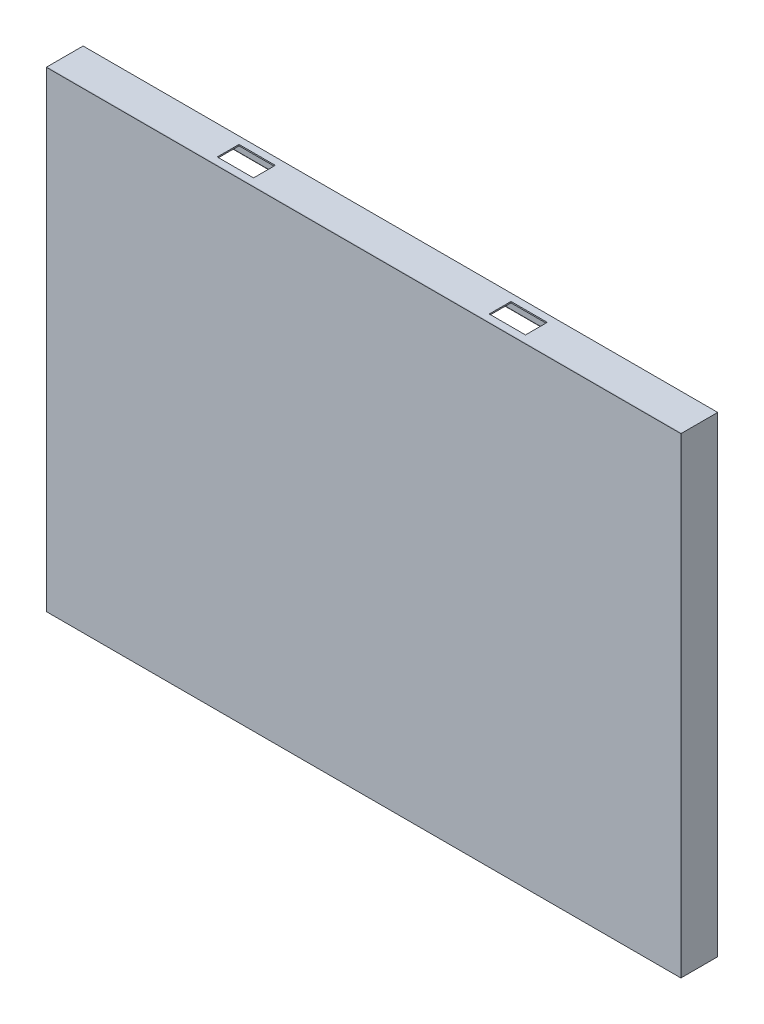
from build123d import *

# Parameters (mm, degrees)
MEMBER_1_DEPTH       = 2813.906082581
MEMBER_1_DEPTH_BACK  = 213.906082581
MEMBER_1_2_DEPTH     = 3927.812165162
MEMBER_1_3_DEPTH     = 3027.812165162
MEMBER_1_4_DEPTH     = 3927.812165162
MEMBER_2_DEPTH       = 2600
MEMBER_3_DEPTH       = 2600
MEMBER_4_DEPTH       = 3500
MEMBER_5_DEPTH       = 3500
WELD_START           = -1743
WELD_TRIM_1_DEPTH    = 1443
WELD_START_2         = -351
WELD_TRIM_1_2_DEPTH  = 75
WELD_START_3         = 300
WELD_TRIM_1_3_DEPTH  = 1443
WELD_TRIM_1_4_DEPTH  = 75
WELD_START_4         = -350
WELD_TRIM_1_5_DEPTH  = 73
WELD_TRIM_1_6_DEPTH  = 1443
WELD_START_5         = 176
WELD_TRIM_1_7_DEPTH  = 75
WELD_TRIM_1_8_DEPTH  = 1443
WELD_TRIM_1_9_DEPTH  = 75
WELD_START_6         = 177
WELD_TRIM_1_10_DEPTH = 73
WELD_START_7         = -301
WELD_TRIM_2_DEPTH    = 75
WELD_START_8         = 226
WELD_TRIM_2_2_DEPTH  = 75
SKETCH_11_W          = 3500
SKETCH_11_H          = 2600
EXTRUDE_3_DEPTH      = 3
SKETCH_14_W          = 200
SKETCH_14_H          = 120
CUT_EXTRUDE_3_DEPTH  = 10
SKETCH_15_W          = 200
SKETCH_15_H          = 120
CUT_EXTRUDE_4_DEPTH  = 3141.461749488


with BuildPart() as part:
    # Sketch1 → Member 1 (new, two sides: drawn at the far end of the back side and taken through both)
    with BuildSketch(Plane(origin=(-1750, -1300, 0), x_dir=(-1, 0, 0), z_dir=(0, 1, 0)).offset(-MEMBER_1_DEPTH_BACK)):
        with BuildLine():
            Line((0, 0), (0, -200))
            Line((0, -200), (-73, -200))
            Line((-73, -200), (-73, -196.033179359))
            ThreePointArc((-73, -196.033179359), (-71.483577577, -192.240936001), (-67.770505569, -190.539835501))
            Line((-67.770505569, -190.539835501), (-17.458988863, -188.062374452))
            ThreePointArc((-17.458988863, -188.062374452), (-10.032844845, -184.660173452), (-7, -177.075686736))
            Line((-7, -177.075686736), (-7, -22.924313264))
            ThreePointArc((-7, -22.924313264), (-10.032844845, -15.339826548), (-17.458988863, -11.937625548))
            Line((-17.458988863, -11.937625548), (-67.770505569, -9.460164499))
            ThreePointArc((-67.770505569, -9.460164499), (-71.483577577, -7.759063999), (-73, -3.966820641))
            Line((-73, -3.966820641), (-73, 0))
            Line((-73, 0), (0, 0))
        make_face()
    extrude(amount=MEMBER_1_DEPTH + MEMBER_1_DEPTH_BACK)

    # Member 1 mitre 1
    split(bisect_by=Plane(origin=(-1750, -1300, 0), x_dir=(-0.707106781, -0.707106781, 0), z_dir=(-0.707106781, 0.707106781, 0)), keep=Keep.TOP)

    # Member 1 mitre 2
    split(bisect_by=Plane(origin=(-1750, 1300, 0), x_dir=(0.707106781, -0.707106781, 0), z_dir=(-0.707106781, -0.707106781, 0)), keep=Keep.TOP)


with BuildPart() as body_2:
    # Sketch1 on segment 2 (carried to segment 2) → Member 1 2 (new body)
    with BuildSketch(Plane(origin=(-1963.906082581, 1300, 0), x_dir=(0, 1, 0), z_dir=(1, 0, 0))):
        with BuildLine():
            Line((0, 0), (0, -200))
            Line((0, -200), (-73, -200))
            Line((-73, -200), (-73, -196.033179359))
            ThreePointArc((-73, -196.033179359), (-71.483577577, -192.240936001), (-67.770505569, -190.539835501))
            Line((-67.770505569, -190.539835501), (-17.458988863, -188.062374452))
            ThreePointArc((-17.458988863, -188.062374452), (-10.032844845, -184.660173452), (-7, -177.075686736))
            Line((-7, -177.075686736), (-7, -22.924313264))
            ThreePointArc((-7, -22.924313264), (-10.032844845, -15.339826548), (-17.458988863, -11.937625548))
            Line((-17.458988863, -11.937625548), (-67.770505569, -9.460164499))
            ThreePointArc((-67.770505569, -9.460164499), (-71.483577577, -7.759063999), (-73, -3.966820641))
            Line((-73, -3.966820641), (-73, 0))
            Line((-73, 0), (0, 0))
        make_face()
    extrude(amount=MEMBER_1_2_DEPTH)

    # Member 1 2 mitre 1
    split(bisect_by=Plane(origin=(1750, 1300, 0), x_dir=(-0.707106781, -0.707106781, 0), z_dir=(-0.707106781, 0.707106781, 0)), keep=Keep.TOP)

    # Member 1 2 mitre 2
    split(bisect_by=Plane(origin=(-1750, 1300, 0), x_dir=(-0.707106781, 0.707106781, 0), z_dir=(0.707106781, 0.707106781, 0)), keep=Keep.TOP)

    # 草图14 → 切除-拉伸3 (cut)
    with BuildSketch(Plane(origin=(0, 1300, 0), x_dir=(1, 0, 0), z_dir=(0, 1, 0))):
        with Locations((-750, 100)):
            Rectangle(SKETCH_14_W, SKETCH_14_H)
        with Locations((750, 100)):
            Rectangle(SKETCH_14_W, SKETCH_14_H)
    extrude(amount=-CUT_EXTRUDE_3_DEPTH, mode=Mode.SUBTRACT)


with BuildPart() as body_3:
    # Sketch1 on segment 3 (carried to segment 3) → Member 1 3 (new body)
    with BuildSketch(Plane(origin=(1750, 1513.906082581, 0), x_dir=(1, 0, 0), z_dir=(0, -1, 0))):
        with BuildLine():
            Line((0, 0), (0, -200))
            Line((0, -200), (-73, -200))
            Line((-73, -200), (-73, -196.033179359))
            ThreePointArc((-73, -196.033179359), (-71.483577577, -192.240936001), (-67.770505569, -190.539835501))
            Line((-67.770505569, -190.539835501), (-17.458988863, -188.062374452))
            ThreePointArc((-17.458988863, -188.062374452), (-10.032844845, -184.660173452), (-7, -177.075686736))
            Line((-7, -177.075686736), (-7, -22.924313264))
            ThreePointArc((-7, -22.924313264), (-10.032844845, -15.339826548), (-17.458988863, -11.937625548))
            Line((-17.458988863, -11.937625548), (-67.770505569, -9.460164499))
            ThreePointArc((-67.770505569, -9.460164499), (-71.483577577, -7.759063999), (-73, -3.966820641))
            Line((-73, -3.966820641), (-73, 0))
            Line((-73, 0), (0, 0))
        make_face()
    extrude(amount=MEMBER_1_3_DEPTH)

    # Member 1 3 mitre 1
    split(bisect_by=Plane(origin=(1750, -1300, 0), x_dir=(-0.707106781, 0.707106781, 0), z_dir=(0.707106781, 0.707106781, 0)), keep=Keep.TOP)

    # Member 1 3 mitre 2
    split(bisect_by=Plane(origin=(1750, 1300, 0), x_dir=(0.707106781, 0.707106781, 0), z_dir=(0.707106781, -0.707106781, 0)), keep=Keep.TOP)


with BuildPart() as body_4:
    # Sketch1 on segment 4 (carried to segment 4) → Member 1 4 (new body)
    with BuildSketch(Plane(origin=(1963.906082581, -1300, 0), x_dir=(0, -1, 0), z_dir=(-1, 0, 0))):
        with BuildLine():
            Line((0, 0), (0, -200))
            Line((0, -200), (-73, -200))
            Line((-73, -200), (-73, -196.033179359))
            ThreePointArc((-73, -196.033179359), (-71.483577577, -192.240936001), (-67.770505569, -190.539835501))
            Line((-67.770505569, -190.539835501), (-17.458988863, -188.062374452))
            ThreePointArc((-17.458988863, -188.062374452), (-10.032844845, -184.660173452), (-7, -177.075686736))
            Line((-7, -177.075686736), (-7, -22.924313264))
            ThreePointArc((-7, -22.924313264), (-10.032844845, -15.339826548), (-17.458988863, -11.937625548))
            Line((-17.458988863, -11.937625548), (-67.770505569, -9.460164499))
            ThreePointArc((-67.770505569, -9.460164499), (-71.483577577, -7.759063999), (-73, -3.966820641))
            Line((-73, -3.966820641), (-73, 0))
            Line((-73, 0), (0, 0))
        make_face()
    extrude(amount=MEMBER_1_4_DEPTH)

    # Member 1 4 mitre 1
    split(bisect_by=Plane(origin=(1750, -1300, 0), x_dir=(0.707106781, -0.707106781, 0), z_dir=(-0.707106781, -0.707106781, 0)), keep=Keep.TOP)

    # Member 1 4 mitre 2
    split(bisect_by=Plane(origin=(-1750, -1300, 0), x_dir=(0.707106781, 0.707106781, 0), z_dir=(0.707106781, -0.707106781, 0)), keep=Keep.TOP)


with BuildPart() as body_5:
    # Sketch11 → Member 2 (new body)
    with BuildSketch(Plane(origin=(-300, 1300, -200), x_dir=(-1, 0, 0), z_dir=(0, -1, 0))):
        with BuildLine():
            Line((0, 0), (0, -200))
            Line((0, -200), (-73, -200))
            Line((-73, -200), (-73, -196.033179359))
            ThreePointArc((-73, -196.033179359), (-71.483577577, -192.240936001), (-67.770505569, -190.539835501))
            Line((-67.770505569, -190.539835501), (-17.458988863, -188.062374452))
            ThreePointArc((-17.458988863, -188.062374452), (-10.032844845, -184.660173452), (-7, -177.075686736))
            Line((-7, -177.075686736), (-7, -22.924313264))
            ThreePointArc((-7, -22.924313264), (-10.032844845, -15.339826548), (-17.458988863, -11.937625548))
            Line((-17.458988863, -11.937625548), (-67.770505569, -9.460164499))
            ThreePointArc((-67.770505569, -9.460164499), (-71.483577577, -7.759063999), (-73, -3.966820641))
            Line((-73, -3.966820641), (-73, 0))
            Line((-73, 0), (0, 0))
        make_face()
    extrude(amount=MEMBER_2_DEPTH)

    # Weld Trim 2: read off the stored shape, not the designer's step
    # Weld Trim 2 outline → Weld Trim 2 (cut)
    with BuildSketch(Plane.YZ.offset(WELD_START_7)):
        Polygon((1227, 0), (1227, -9.202651515), (1282.541011137, -11.937625548), (1293, -22.924313264), (1293, -177.075686736), (1282.541011137, -188.062374452), (1227, -190.797348485), (1227, -200), (1300, -200), (1300, 0), align=None)
        Polygon((-1227, -9.202651515), (-1227, 0), (-1300, 0), (-1300, -200), (-1227, -200), (-1227, -190.797348485), (-1282.541011137, -188.062374452), (-1293, -177.075686736), (-1293, -22.924313264), (-1282.541011137, -11.937625548), align=None)
    extrude(amount=WELD_TRIM_2_DEPTH, mode=Mode.SUBTRACT)


with BuildPart() as body_6:
    # Sketch12 → Member 3 (new body)
    with BuildSketch(Plane(origin=(300, 1300, 0), x_dir=(1, 0, 0), z_dir=(0, -1, 0))):
        with BuildLine():
            Line((0, 0), (0, -200))
            Line((0, -200), (-73, -200))
            Line((-73, -200), (-73, -196.033179359))
            ThreePointArc((-73, -196.033179359), (-71.483577577, -192.240936001), (-67.770505569, -190.539835501))
            Line((-67.770505569, -190.539835501), (-17.458988863, -188.062374452))
            ThreePointArc((-17.458988863, -188.062374452), (-10.032844845, -184.660173452), (-7, -177.075686736))
            Line((-7, -177.075686736), (-7, -22.924313264))
            ThreePointArc((-7, -22.924313264), (-10.032844845, -15.339826548), (-17.458988863, -11.937625548))
            Line((-17.458988863, -11.937625548), (-67.770505569, -9.460164499))
            ThreePointArc((-67.770505569, -9.460164499), (-71.483577577, -7.759063999), (-73, -3.966820641))
            Line((-73, -3.966820641), (-73, 0))
            Line((-73, 0), (0, 0))
        make_face()
    extrude(amount=MEMBER_3_DEPTH)

    # Weld Trim 2 2 outline → Weld Trim 2 2 (cut)
    with BuildSketch(Plane.YZ.offset(WELD_START_8)):
        Polygon((1227, 0), (1227, -9.202651515), (1282.541011137, -11.937625548), (1293, -22.924313264), (1293, -177.075686736), (1282.541011137, -188.062374452), (1227, -190.797348485), (1227, -200), (1300, -200), (1300, 0), align=None)
        Polygon((-1227, -9.202651515), (-1227, 0), (-1300, 0), (-1300, -200), (-1227, -200), (-1227, -190.797348485), (-1282.541011137, -188.062374452), (-1293, -177.075686736), (-1293, -22.924313264), (-1282.541011137, -11.937625548), align=None)
    extrude(amount=WELD_TRIM_2_2_DEPTH, mode=Mode.SUBTRACT)


with BuildPart() as body_7:
    # Sketch13 → Member 4 (new body)
    with BuildSketch(Plane(origin=(-1750, 250, 0), x_dir=(0, 1, 0), z_dir=(1, 0, 0))):
        with BuildLine():
            Line((0, 0), (0, -200))
            Line((0, -200), (-73, -200))
            Line((-73, -200), (-73, -196.033179359))
            ThreePointArc((-73, -196.033179359), (-71.483577577, -192.240936001), (-67.770505569, -190.539835501))
            Line((-67.770505569, -190.539835501), (-17.458988863, -188.062374452))
            ThreePointArc((-17.458988863, -188.062374452), (-10.032844845, -184.660173452), (-7, -177.075686736))
            Line((-7, -177.075686736), (-7, -22.924313264))
            ThreePointArc((-7, -22.924313264), (-10.032844845, -15.339826548), (-17.458988863, -11.937625548))
            Line((-17.458988863, -11.937625548), (-67.770505569, -9.460164499))
            ThreePointArc((-67.770505569, -9.460164499), (-71.483577577, -7.759063999), (-73, -3.966820641))
            Line((-73, -3.966820641), (-73, 0))
            Line((-73, 0), (0, 0))
        make_face()
    extrude(amount=MEMBER_4_DEPTH)

    # Weld Trim 1 10 outline → Weld Trim 1 10 (cut)
    with BuildSketch(Plane(origin=(0, 0, 0), x_dir=(1, 0, 0), z_dir=(0, 1, 0)).offset(WELD_START_6)):
        Polygon((227, 190.797348485), (282.541011137, 188.062374452), (293, 177.075686736), (293, 22.924313264), (282.541011137, 11.937625548), (227, 9.202651515), (227, 0), (1750, 0), (1750, 200), (227, 200), align=None)
        Polygon((-227, 190.797348485), (-227, 200), (-1750, 200), (-1750, 0), (-227, 0), (-227, 9.202651515), (-282.541011137, 11.937625548), (-293, 22.924313264), (-293, 177.075686736), (-282.541011137, 188.062374452), align=None)
    extrude(amount=WELD_TRIM_1_10_DEPTH, mode=Mode.SUBTRACT)


with BuildPart() as body_8:
    # Sketch14 → Member 5 (new body)
    with BuildSketch(Plane(origin=(-1750, -350, -200), x_dir=(0, -1, 0), z_dir=(1, 0, 0))):
        with BuildLine():
            Line((0, 0), (0, -200))
            Line((0, -200), (-73, -200))
            Line((-73, -200), (-73, -196.033179359))
            ThreePointArc((-73, -196.033179359), (-71.483577577, -192.240936001), (-67.770505569, -190.539835501))
            Line((-67.770505569, -190.539835501), (-17.458988863, -188.062374452))
            ThreePointArc((-17.458988863, -188.062374452), (-10.032844845, -184.660173452), (-7, -177.075686736))
            Line((-7, -177.075686736), (-7, -22.924313264))
            ThreePointArc((-7, -22.924313264), (-10.032844845, -15.339826548), (-17.458988863, -11.937625548))
            Line((-17.458988863, -11.937625548), (-67.770505569, -9.460164499))
            ThreePointArc((-67.770505569, -9.460164499), (-71.483577577, -7.759063999), (-73, -3.966820641))
            Line((-73, -3.966820641), (-73, 0))
            Line((-73, 0), (0, 0))
        make_face()
    extrude(amount=MEMBER_5_DEPTH)

    # Weld Trim 1 5 outline → Weld Trim 1 5 (cut)
    with BuildSketch(Plane(origin=(0, 0, 0), x_dir=(1, 0, 0), z_dir=(0, 1, 0)).offset(WELD_START_4)):
        Polygon((293, 177.075686736), (293, 22.924313264), (282.541011137, 11.937625548), (227, 9.202651515), (227, 0), (1750, 0), (1750, 200), (227, 200), (227, 190.797348485), (282.541011137, 188.062374452), align=None)
        Polygon((-1750, 0), (-227, 0), (-227, 9.202651515), (-282.541011137, 11.937625548), (-293, 22.924313264), (-293, 177.075686736), (-282.541011137, 188.062374452), (-227, 190.797348485), (-227, 200), (-1750, 200), align=None)
    extrude(amount=WELD_TRIM_1_5_DEPTH, mode=Mode.SUBTRACT)


with BuildPart() as body_9:
    # Weld Trim 1: read off the stored shape, not the designer's step
    # Weld Trim 1 outline → Weld Trim 1 (new body)
    with BuildSketch(Plane.YZ.offset(WELD_START)):
        with BuildLine():
            Line((-343, -177.075686736), (-343, -22.924313264))
            ThreePointArc((-343, -22.924313264), (-339.967155155, -15.339826547), (-332.541011137, -11.937625548))
            Line((-332.541011137, -11.937625548), (-282.229494431, -9.460164499))
            ThreePointArc((-282.229494431, -9.460164499), (-278.516422423, -7.759063999), (-277, -3.966820641))
            Line((-277, -3.966820641), (-277, 0))
            Line((-277, 0), (-350, 0))
            Line((-350, 0), (-350, -200))
            Line((-350, -200), (-277, -200))
            Line((-277, -200), (-277, -196.033179359))
            ThreePointArc((-277, -196.033179359), (-278.516422423, -192.240936001), (-282.229494431, -190.539835501))
            Line((-282.229494431, -190.539835501), (-332.541011137, -188.062374452))
            ThreePointArc((-332.541011137, -188.062374452), (-339.967155155, -184.660173453), (-343, -177.075686736))
        make_face()
    extrude(amount=WELD_TRIM_1_DEPTH)

    # Weld Trim 1 2 outline → Weld Trim 1 2 (cut)
    with BuildSketch(Plane(origin=(0, 0, 0), x_dir=(1, 0, 0), z_dir=(0, 1, 0)).offset(WELD_START_2)):
        Polygon((-1732.541011137, 11.937625548), (-1743, 22.924313264), (-1743, 0), (-1677, 0), (-1677, 9.202651515), align=None)
        Polygon((-1677, 190.797348485), (-1677, 200), (-1743, 200), (-1743, 177.075686736), (-1732.541011137, 188.062374452), align=None)
    extrude(amount=WELD_TRIM_1_2_DEPTH, mode=Mode.SUBTRACT)


with BuildPart() as body_10:
    # Weld Trim 1 3 outline → Weld Trim 1 3 (new body)
    with BuildSketch(Plane.YZ.offset(WELD_START_3)):
        with BuildLine():
            Line((-277, -3.966820641), (-277, 0))
            Line((-277, 0), (-350, 0))
            Line((-350, 0), (-350, -200))
            Line((-350, -200), (-277, -200))
            Line((-277, -200), (-277, -196.033179359))
            ThreePointArc((-277, -196.033179359), (-278.516422423, -192.240936001), (-282.229494431, -190.539835501))
            Line((-282.229494431, -190.539835501), (-332.541011137, -188.062374452))
            ThreePointArc((-332.541011137, -188.062374452), (-339.967155155, -184.660173453), (-343, -177.075686736))
            Line((-343, -177.075686736), (-343, -22.924313264))
            ThreePointArc((-343, -22.924313264), (-339.967155155, -15.339826547), (-332.541011137, -11.937625548))
            Line((-332.541011137, -11.937625548), (-282.229494431, -9.460164499))
            ThreePointArc((-282.229494431, -9.460164499), (-278.516422423, -7.759063999), (-277, -3.966820641))
        make_face()
    extrude(amount=WELD_TRIM_1_3_DEPTH)

    # Weld Trim 1 4 outline → Weld Trim 1 4 (cut)
    with BuildSketch(Plane(origin=(0, 0, 0), x_dir=(1, 0, 0), z_dir=(0, 1, 0)).offset(WELD_START_2)):
        Polygon((1732.541011137, 188.062374452), (1743, 177.075686736), (1743, 200), (1677, 200), (1677, 190.797348485), align=None)
        Polygon((1677, 9.202651515), (1677, 0), (1743, 0), (1743, 22.924313264), (1732.541011137, 11.937625548), align=None)
    extrude(amount=WELD_TRIM_1_4_DEPTH, mode=Mode.SUBTRACT)


with BuildPart() as body_11:
    # Weld Trim 1 6 outline → Weld Trim 1 6 (new body)
    with BuildSketch(Plane.YZ.offset(WELD_START)):
        with BuildLine():
            Line((177, -196.033179359), (177, -200))
            Line((177, -200), (250, -200))
            Line((250, -200), (250, 0))
            Line((250, 0), (177, 0))
            Line((177, 0), (177, -3.966820641))
            ThreePointArc((177, -3.966820641), (178.516422423, -7.759063999), (182.229494431, -9.460164499))
            Line((182.229494431, -9.460164499), (232.541011137, -11.937625548))
            ThreePointArc((232.541011137, -11.937625548), (239.967155155, -15.339826547), (243, -22.924313264))
            Line((243, -22.924313264), (243, -177.075686736))
            ThreePointArc((243, -177.075686736), (239.967155155, -184.660173453), (232.541011137, -188.062374452))
            Line((232.541011137, -188.062374452), (182.229494431, -190.539835501))
            ThreePointArc((182.229494431, -190.539835501), (178.516422423, -192.240936001), (177, -196.033179359))
        make_face()
    extrude(amount=WELD_TRIM_1_6_DEPTH)

    # Weld Trim 1 7 outline → Weld Trim 1 7 (cut)
    with BuildSketch(Plane(origin=(0, 0, 0), x_dir=(1, 0, 0), z_dir=(0, 1, 0)).offset(WELD_START_5)):
        Polygon((-1743, 200), (-1743, 177.075686736), (-1732.541011137, 188.062374452), (-1677, 190.797348485), (-1677, 200), align=None)
        Polygon((-1677, 0), (-1677, 9.202651515), (-1732.541011137, 11.937625548), (-1743, 22.924313264), (-1743, 0), align=None)
    extrude(amount=WELD_TRIM_1_7_DEPTH, mode=Mode.SUBTRACT)


with BuildPart() as body_12:
    # Weld Trim 1 8 outline → Weld Trim 1 8 (new body)
    with BuildSketch(Plane.YZ.offset(WELD_START_3)):
        with BuildLine():
            Line((177, -200), (250, -200))
            Line((250, -200), (250, 0))
            Line((250, 0), (177, 0))
            Line((177, 0), (177, -3.966820641))
            ThreePointArc((177, -3.966820641), (178.516422423, -7.759063999), (182.229494431, -9.460164499))
            Line((182.229494431, -9.460164499), (232.541011137, -11.937625548))
            ThreePointArc((232.541011137, -11.937625548), (239.967155155, -15.339826547), (243, -22.924313264))
            Line((243, -22.924313264), (243, -177.075686736))
            ThreePointArc((243, -177.075686736), (239.967155155, -184.660173453), (232.541011137, -188.062374452))
            Line((232.541011137, -188.062374452), (182.229494431, -190.539835501))
            ThreePointArc((182.229494431, -190.539835501), (178.516422423, -192.240936001), (177, -196.033179359))
            Line((177, -196.033179359), (177, -200))
        make_face()
    extrude(amount=WELD_TRIM_1_8_DEPTH)

    # Weld Trim 1 9 outline → Weld Trim 1 9 (cut)
    with BuildSketch(Plane(origin=(0, 0, 0), x_dir=(1, 0, 0), z_dir=(0, 1, 0)).offset(WELD_START_5)):
        Polygon((1732.541011137, 188.062374452), (1743, 177.075686736), (1743, 200), (1677, 200), (1677, 190.797348485), align=None)
        Polygon((1677, 9.202651515), (1677, 0), (1743, 0), (1743, 22.924313264), (1732.541011137, 11.937625548), align=None)
    extrude(amount=WELD_TRIM_1_9_DEPTH, mode=Mode.SUBTRACT)


with BuildPart() as body_13:
    # 草图11 → 凸台-拉伸3 (new body)
    with BuildSketch(Plane.XY):
        Rectangle(SKETCH_11_W, SKETCH_11_H)
    extrude(amount=EXTRUDE_3_DEPTH)


with BuildPart() as cut_extrude_4_tool:
    # 草图15 → 切除-拉伸4 (new, through all)
    with BuildSketch(Plane(origin=(0, -1300, 0), x_dir=(-1, 0, 0), z_dir=(0, -1, 0))):
        with Locations((750, 100)):
            Rectangle(SKETCH_15_W, SKETCH_15_H)
        with Locations((-750, 100)):
            Rectangle(SKETCH_15_W, SKETCH_15_H)
    extrude(amount=-CUT_EXTRUDE_4_DEPTH)


with BuildPart() as body_4_1:
    add(body_4.part)

    # 切除-拉伸4: cut by cut_extrude_4_tool
    add(cut_extrude_4_tool.part, mode=Mode.SUBTRACT)


with BuildPart() as body_9_1:
    add(body_9.part)

    # 切除-拉伸4: cut by cut_extrude_4_tool
    add(cut_extrude_4_tool.part, mode=Mode.SUBTRACT)


with BuildPart() as body_10_1:
    add(body_10.part)

    # 切除-拉伸4: cut by cut_extrude_4_tool
    add(cut_extrude_4_tool.part, mode=Mode.SUBTRACT)


with BuildPart() as body_11_1:
    add(body_11.part)

    # 切除-拉伸4: cut by cut_extrude_4_tool
    add(cut_extrude_4_tool.part, mode=Mode.SUBTRACT)


with BuildPart() as body_12_1:
    add(body_12.part)

    # 切除-拉伸4: cut by cut_extrude_4_tool
    add(cut_extrude_4_tool.part, mode=Mode.SUBTRACT)


solid = Compound([part.part, body_2.part, body_3.part, body_5.part, body_6.part, body_7.part, body_8.part, body_13.part, body_4_1.part, body_9_1.part, body_10_1.part, body_11_1.part, body_12_1.part])
